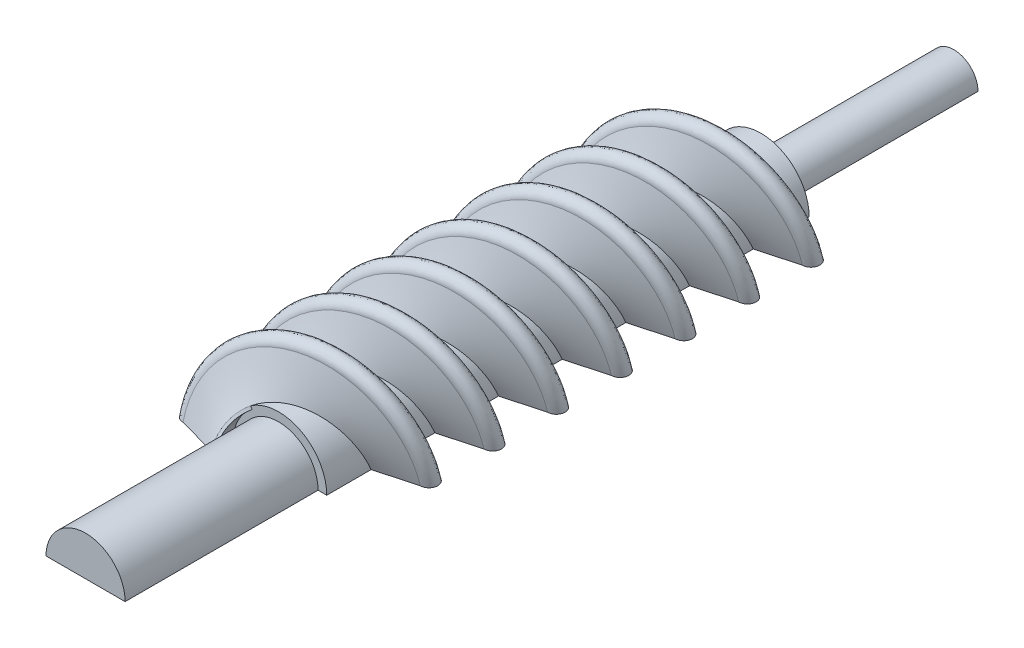
from build123d import *

# Parameters (mm, degrees)
ESQUISSE1_R             = 5
BOSS_EXTRU_1_DEPTH      = 50
BALAYAGE2_PITCH         = 13.2
CIRPATTERN1_COUNT       = 2
BOSS_EXTRU_3_DEPTH      = 20
BOSS_EXTRU_3_DEPTH_BACK = 70
ARBRE_R                 = 2.5
ESQUISSE8_R             = 4.1
BOSS_EXTRU_4_DEPTH      = 20
CUT_EXTRUDE1_DEPTH      = 92.082490106


with BuildPart() as part:
    # Esquisse1 → Boss.-Extru.1 (new body)
    with BuildSketch(Plane.XY):
        Circle(ESQUISSE1_R)
    extrude(amount=BOSS_EXTRU_1_DEPTH)

    # Balayage2: the profile of Esquisse4 screwed along a right-hand helix of 3.5 turns, 18 arcs to a turn; built about Z, then put on its axis
    balayage2_z = Axis((0, 0, 0), (0, 0, 1))
    balayage2_corners = [(9, 0, 0.9), (5, 0, 2), (4.702014603, 0, 2), (4.702014603, 0, -2), (5, 0, -2), (9, 0, -0.9), (9.9, 0, 0)]
    with BuildLine(mode=Mode.PRIVATE) as balayage2_profile:
        Line(balayage2_corners[0], balayage2_corners[1])
        Line(balayage2_corners[1], balayage2_corners[2])
        Line(balayage2_corners[2], balayage2_corners[3])
        Line(balayage2_corners[3], balayage2_corners[4])
        Line(balayage2_corners[4], balayage2_corners[5])
        ThreePointArc((9, 0, -0.9), (9.636396103, 0, -0.636396103), (9.9, 0, 0))
        ThreePointArc((9.9, 0, 0), (9.636396103, 0, 0.636396103), (9, 0, 0.9))
    balayage2_cap = Face(balayage2_profile.wire())
    balayage2_arcs = [((9, 0, -0.9), (9.9, 0, -0.9), (9.9, 0, 0), (1, 0.7071067811865511, 1)), ((9.9, 0, 0), (9.9, 0, 0.9), (9, 0, 0.9), (1, 0.7071067811865511, 1))]  # start, shoulder, end, weights
    balayage2_turn_angles = [0, 10, 20, 30, 40, 50, 60, 70, 80, 90, 100, 110, 120, 130, 140, 150, 160, 170, 180, 190, 200, 210, 220, 230, 240, 250, 260, 270, 280, 290, 300, 310, 320, 330, 340, 350, 360]
    balayage2_turn_weights = [1, 0.984807753012208, 1, 0.984807753012208, 1, 0.984807753012208, 1, 0.984807753012208, 1, 0.984807753012208, 1, 0.984807753012208, 1, 0.984807753012208, 1, 0.984807753012208, 1, 0.984807753012208, 1, 0.984807753012208, 1, 0.984807753012208, 1, 0.984807753012208, 1, 0.984807753012208, 1, 0.984807753012208, 1, 0.984807753012208, 1, 0.984807753012208, 1, 0.984807753012208, 1, 0.984807753012208, 1]
    balayage2_turn_rails = [Edge.make_bspline([Vector(p[0], p[1], 0).rotate(balayage2_z, balayage2_turn_angles[k]) / balayage2_turn_weights[k] + Vector(0, 0, p[2] + BALAYAGE2_PITCH * balayage2_turn_angles[k] / 360) for k in range(37)], [0, 0, 0, 1, 1, 2, 2, 3, 3, 4, 4, 5, 5, 6, 6, 7, 7, 8, 8, 9, 9, 10, 10, 11, 11, 12, 12, 13, 13, 14, 14, 15, 15, 16, 16, 17, 17, 18, 18, 18], 2, balayage2_turn_weights) for p in balayage2_corners]
    balayage2_turn_sides = [*[Face.make_surface_from_curves(balayage2_turn_rails[p[0]], balayage2_turn_rails[p[1]]) for p in [(0, 1), (1, 2), (2, 3), (3, 4), (4, 5)]], *[Face.make_bezier_surface([[Vector(p[j][0], p[j][1], 0).rotate(balayage2_z, balayage2_turn_angles[2 * i + k]) / balayage2_turn_weights[2 * i + k] + Vector(0, 0, p[j][2] + BALAYAGE2_PITCH * balayage2_turn_angles[2 * i + k] / 360) for k in range(3)] for j in range(3)], [[p[3][j] * balayage2_turn_weights[2 * i + k] for k in range(3)] for j in range(3)]) for p in balayage2_arcs for i in range(18)]]
    balayage2_last_angles = [1080, 1090, 1100, 1110, 1120, 1130, 1140, 1150, 1160, 1170, 1180, 1190, 1200, 1210, 1220, 1230, 1240, 1250, 1260]
    balayage2_last_weights = [1, 0.984807753012208, 1, 0.984807753012208, 1, 0.984807753012208, 1, 0.984807753012208, 1, 0.984807753012208, 1, 0.984807753012208, 1, 0.984807753012208, 1, 0.984807753012208, 1, 0.9848077530122057, 1]
    balayage2_last_rails = [Edge.make_bspline([Vector(p[0], p[1], 0).rotate(balayage2_z, balayage2_last_angles[k]) / balayage2_last_weights[k] + Vector(0, 0, p[2] + BALAYAGE2_PITCH * balayage2_last_angles[k] / 360) for k in range(19)], [0, 0, 0, 1, 1, 2, 2, 3, 3, 4, 4, 5, 5, 6, 6, 7, 7, 8, 8, 9, 9, 9], 2, balayage2_last_weights) for p in balayage2_corners]
    balayage2_last_sides = [*[Face.make_surface_from_curves(balayage2_last_rails[p[0]], balayage2_last_rails[p[1]]) for p in [(0, 1), (1, 2), (2, 3), (3, 4), (4, 5)]], *[Face.make_bezier_surface([[Vector(p[j][0], p[j][1], 0).rotate(balayage2_z, balayage2_last_angles[2 * i + k]) / balayage2_last_weights[2 * i + k] + Vector(0, 0, p[j][2] + BALAYAGE2_PITCH * balayage2_last_angles[2 * i + k] / 360) for k in range(3)] for j in range(3)], [[p[3][j] * balayage2_last_weights[2 * i + k] for k in range(3)] for j in range(3)]) for p in balayage2_arcs for i in range(9)]]
    balayage2 = Plane(origin=(0, 0, 50), x_dir=(-1, 0, 0), z_dir=(0, 0, -1)) * Solid(Shell([*[p.moved(Location((0, 0, BALAYAGE2_PITCH * i))) for i in range(3) for p in balayage2_turn_sides], *balayage2_last_sides, balayage2_cap, balayage2_cap.rotate(balayage2_z, 1260).moved(Location((0, 0, BALAYAGE2_PITCH * 1260 / 360)))]))
    add(balayage2)

    # CirPattern1: Balayage2 ×2 about axis
    cirpattern1_axis = Axis((0, 0, 50), (0, 0, -1))
    for i in range(1, CIRPATTERN1_COUNT):
        add(balayage2.rotate(cirpattern1_axis, i * 360 / CIRPATTERN1_COUNT))

    # arbre → Boss.-Extru.3 (add, two sides: drawn at the far end of the back side and taken through both)
    with BuildSketch(Plane(origin=(0, 0, 0), x_dir=(-1, 0, 0), z_dir=(0, 0, -1)).offset(-BOSS_EXTRU_3_DEPTH_BACK)):
        Circle(ARBRE_R)
    extrude(amount=BOSS_EXTRU_3_DEPTH + BOSS_EXTRU_3_DEPTH_BACK)

    # Esquisse8 → Boss.-Extru.4 (add)
    with BuildSketch(Plane.XY.offset(70)):
        Circle(ESQUISSE8_R)
    extrude(amount=-BOSS_EXTRU_4_DEPTH)

    # Sketch1 → Cut-Extrude1 (cut, through all)
    with BuildSketch(Plane.XY.offset(70)):
        Polygon((0, 0), (14.891532527, 0), (14.891532527, -11.359061408), (0, -11.359061408), (-12.028786415, -11.359061408), (-12.028786415, 0), align=None)
    extrude(amount=-CUT_EXTRUDE1_DEPTH, mode=Mode.SUBTRACT)


solid = part.part
